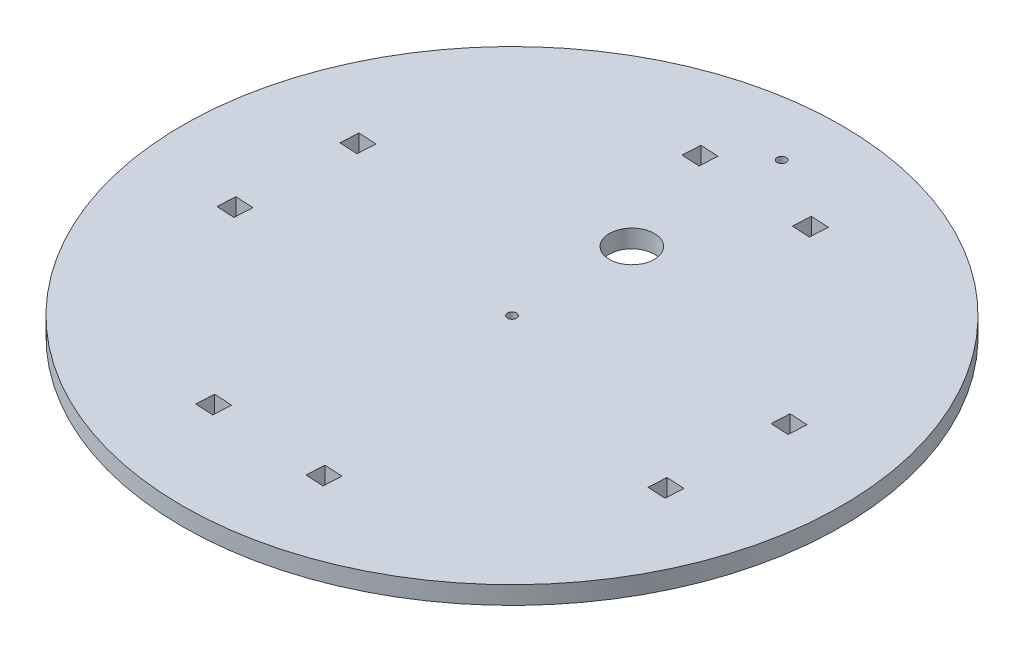
from build123d import *

# Parameters (mm, degrees)
SKETCH1_R           = 110
BOSS_EXTRUDE1_DEPTH = 6
SKETCH2_R           = 7.5
CUT_EXTRUDE1_DEPTH  = 156.679157243
CAVITY1_START       = 73.692998072
CAVITY1_OUTLINE_W   = 6
CAVITY1_OUTLINE_H   = 6
CAVITY1_DEPTH       = 6
CUT_EXTRUDE2_DEPTH  = 156.679157243
SKETCH6_R           = 1.5
CUT_EXTRUDE3_DEPTH  = 156.679157243


# Read off the part's stored shape, not the designer's step: Cavity1
with BuildPart() as part:
    # Sketch1 → Boss-Extrude1 (new body)
    with BuildSketch(Plane(origin=(0, 0, 0), x_dir=(1, 0, 0), z_dir=(0, 1, 0))):
        with Locations(Location((0, 0, 0), (0, 0, 270))):
            Circle(SKETCH1_R)
    extrude(amount=BOSS_EXTRUDE1_DEPTH)

    # Sketch2 → Cut-Extrude1 (cut, through all)
    with BuildSketch(Plane(origin=(0, 6, 0), x_dir=(1, 0, 0), z_dir=(0, 1, 0))):
        with Locations(Location((0, 40, 0), (0, 0, 270))):
            Circle(SKETCH2_R)
    extrude(amount=-CUT_EXTRUDE1_DEPTH, mode=Mode.SUBTRACT)

    # Cavity1 outline → Cavity1 (cut)
    with BuildSketch(Plane(origin=(0, 0, 0), x_dir=(0, 1, 0), z_dir=(0.998532697756286, 0, 0.0541521145621647)).offset(CAVITY1_START)):
        with Locations((3, -19.041827)):
            Rectangle(CAVITY1_OUTLINE_W, CAVITY1_OUTLINE_H)
        with Locations((3, 19.958173)):
            Rectangle(CAVITY1_OUTLINE_W, CAVITY1_OUTLINE_H)
    extrude(amount=CAVITY1_DEPTH, mode=Mode.SUBTRACT)

    # Sketch3 → Cut-Extrude2 (cut, through all)
    with BuildSketch(Plane(origin=(0, 6, 0), x_dir=(1, 0, 0), z_dir=(0, 1, 0))):
        Polygon((-21.248834596, -78.65774343), (-20.923921909, -72.666547244), (-26.915118096, -72.341634556), (-27.240030783, -78.332830743), align=None)
        Polygon((17.693940616, -80.769675898), (11.702744429, -80.444763211), (12.027657117, -74.453567024), (18.018853303, -74.778479712), align=None)
        Polygon((-78.65774343, 21.248834596), (-72.666547244, 20.923921909), (-72.341634556, 26.915118096), (-78.332830743, 27.240030783), align=None)
        Polygon((-80.769675898, -17.693940616), (-80.444763211, -11.702744429), (-74.453567024, -12.027657117), (-74.778479712, -18.018853303), align=None)
        Polygon((21.248834596, 78.65774343), (20.923921909, 72.666547244), (26.915118096, 72.341634556), (27.240030783, 78.332830743), align=None)
        Polygon((-17.693940616, 80.769675898), (-11.702744429, 80.444763211), (-12.027657117, 74.453567024), (-18.018853303, 74.778479712), align=None)
    extrude(amount=-CUT_EXTRUDE2_DEPTH, mode=Mode.SUBTRACT)

    # Sketch6 → Cut-Extrude3 (cut, through all)
    with BuildSketch(Plane(origin=(0, 6, 0), x_dir=(1, 0, 0), z_dir=(0, 1, 0))):
        with Locations(Location((0, 90, 0), (0, 0, 270))):
            Circle(SKETCH6_R)
        with Locations(Location((0, 0, 0), (0, 0, 270))):
            Circle(SKETCH6_R)
    extrude(amount=-CUT_EXTRUDE3_DEPTH, mode=Mode.SUBTRACT)


solid = part.part
